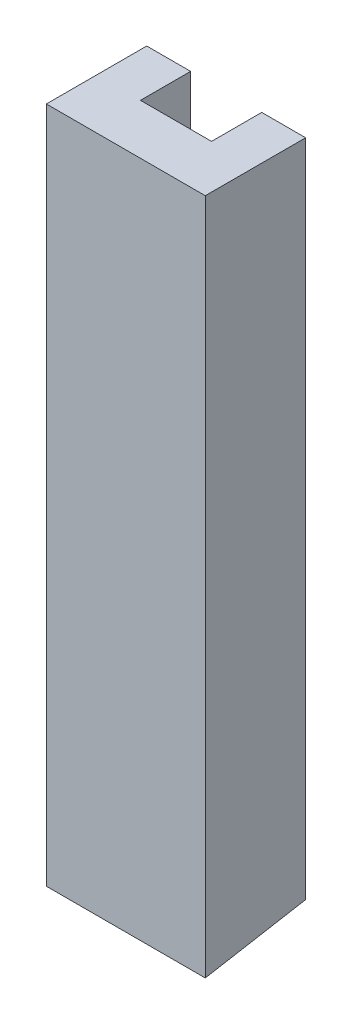
from build123d import *

# Parameters (mm, degrees)
SKETCH1_W           = 19
SKETCH1_H           = 81
BOSS_EXTRUDE1_DEPTH = 12
SKETCH2_W           = 8.5
SKETCH2_H           = 81
CUT_EXTRUDE1_DEPTH  = 6
SKETCH3_W           = 31.784398885
SKETCH3_H           = 20.084620154
CUT_EXTRUDE2_DEPTH  = 81.92153013


with BuildPart() as part:
    # Sketch1 → Boss-Extrude1 (new body)
    with BuildSketch(Plane.XY):
        with Locations((-0.214285714, -27.308823529)):
            Rectangle(SKETCH1_W, SKETCH1_H)
    extrude(amount=BOSS_EXTRUDE1_DEPTH)

    # Sketch2 → Cut-Extrude1 (cut)
    with BuildSketch(Plane(origin=(0, 0, 0), x_dir=(-1, 0, 0), z_dir=(0, 0, -1))):
        with Locations((0.214285714, -27.308823529)):
            Rectangle(SKETCH2_W, SKETCH2_H)
    extrude(amount=-CUT_EXTRUDE1_DEPTH, mode=Mode.SUBTRACT)

    # Sketch3 → Cut-Extrude2 (cut, through all)
    with BuildSketch(Plane(origin=(0, -63.712016452, -11.234147496), x_dir=(1, 0, 0), z_dir=(0, -0.984807753012208, -0.17364817766693072))):
        with Locations((-0.737280551, 17.487835558)):
            Rectangle(SKETCH3_W, SKETCH3_H)
    extrude(amount=CUT_EXTRUDE2_DEPTH, mode=Mode.SUBTRACT)


solid = part.part
